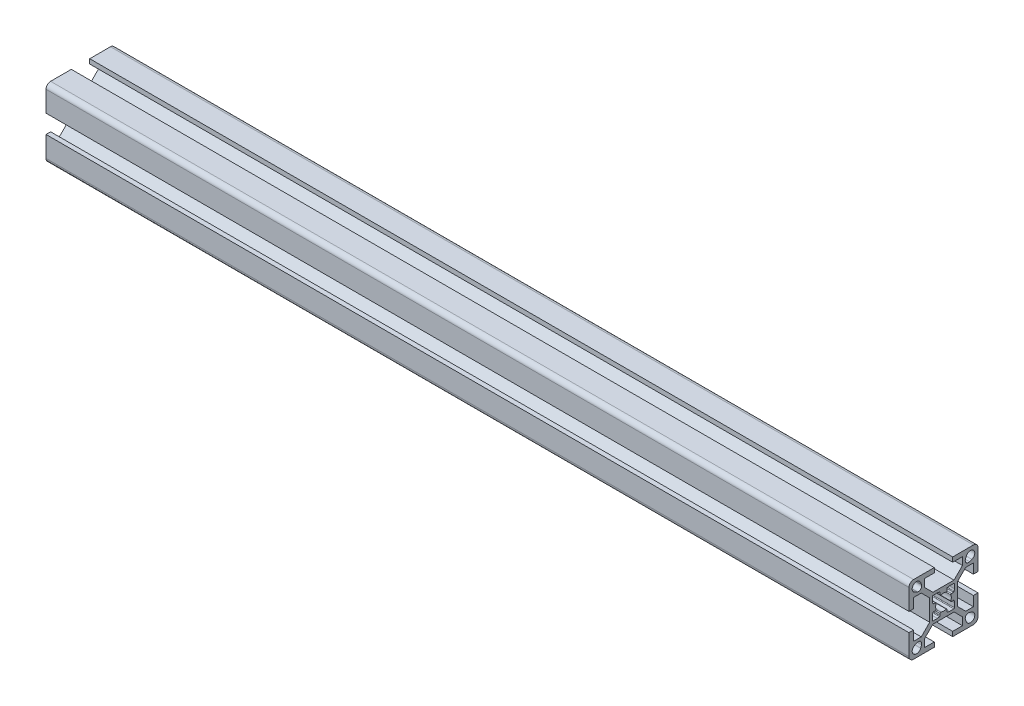
from build123d import *

# Parameters (mm, degrees)
BOSS_EXTRUDE1_DEPTH = 375


with BuildPart() as part:
    # Sketch1 → Boss-Extrude1 (new body)
    with BuildSketch(Plane(origin=(0, 0, 0), x_dir=(0, 0, -1), z_dir=(1, 0, 0))):
        with BuildLine():
            Line((-15, 13), (-15, 4))
            Line((-15, 4), (-13, 4))
            Line((-13, 4), (-13, 8.25))
            Line((-13, 8.25), (-9.664213562, 8.25))
            Line((-9.664213562, 8.25), (-6, 4.585786438))
            Line((-6, 4.585786438), (-6, -4.585786438))
            Line((-6, -4.585786438), (-9.664213562, -8.25))
            Line((-9.664213562, -8.25), (-13, -8.25))
            Line((-13, -8.25), (-13, -4))
            Line((-13, -4), (-15, -4))
            Line((-15, -4), (-15, -13))
            ThreePointArc((-15, -13), (-14.414213562, -14.414213562), (-13, -15))
            Line((-13, -15), (-4, -15))
            Line((-4, -15), (-4, -13))
            Line((-4, -13), (-8.25, -13))
            Line((-8.25, -13), (-8.25, -9.664213562))
            Line((-8.25, -9.664213562), (-4.585786438, -6))
            Line((-4.585786438, -6), (4.585786438, -6))
            Line((4.585786438, -6), (8.25, -9.664213562))
            Line((8.25, -9.664213562), (8.25, -13))
            Line((8.25, -13), (4, -13))
            Line((4, -13), (4, -15))
            Line((4, -15), (13, -15))
            ThreePointArc((13, -15), (14.414213562, -14.414213562), (15, -13))
            Line((15, -13), (15, -4))
            Line((15, -4), (13, -4))
            Line((13, -4), (13, -8.25))
            Line((13, -8.25), (9.664213562, -8.25))
            Line((9.664213562, -8.25), (6, -4.585786438))
            Line((6, -4.585786438), (6, 4.585786438))
            Line((6, 4.585786438), (9.664213562, 8.25))
            Line((9.664213562, 8.25), (13, 8.25))
            Line((13, 8.25), (13, 4))
            Line((13, 4), (15, 4))
            Line((15, 4), (15, 13))
            ThreePointArc((15, 13), (14.414213562, 14.414213562), (13, 15))
            Line((13, 15), (4, 15))
            Line((4, 15), (4, 13))
            Line((4, 13), (8.25, 13))
            Line((8.25, 13), (8.25, 9.664213562))
            Line((8.25, 9.664213562), (4.585786438, 6))
            Line((4.585786438, 6), (-4.585786438, 6))
            Line((-4.585786438, 6), (-8.25, 9.664213562))
            Line((-8.25, 9.664213562), (-8.25, 13))
            Line((-8.25, 13), (-4, 13))
            Line((-4, 13), (-4, 15))
            Line((-4, 15), (-13, 15))
            ThreePointArc((-13, 15), (-14.414213562, 14.414213562), (-15, 13))
        make_face()
        with BuildLine():
            Line((-9.539070071, 11.338915743), (-9.918883282, 12.361530981))
            ThreePointArc((-9.918883282, 12.361530981), (-13.043502884, 13.043502884), (-12.361530981, 9.918883282))
            Line((-12.361530981, 9.918883282), (-11.338915743, 9.539070071))
            ThreePointArc((-11.338915743, 9.539070071), (-9.861522369, 9.861522369), (-9.539070071, 11.338915743))
        make_face(mode=Mode.SUBTRACT)
        with BuildLine():
            Line((9.918883282, 12.361530981), (9.539070071, 11.338915743))
            ThreePointArc((9.539070071, 11.338915743), (9.861522369, 9.861522369), (11.338915743, 9.539070071))
            Line((11.338915743, 9.539070071), (12.361530981, 9.918883282))
            ThreePointArc((12.361530981, 9.918883282), (13.043502884, 13.043502884), (9.918883282, 12.361530981))
        make_face(mode=Mode.SUBTRACT)
        with BuildLine():
            Line((12.361530981, -9.918883282), (11.338915743, -9.539070071))
            ThreePointArc((11.338915743, -9.539070071), (9.861522369, -9.861522369), (9.539070071, -11.338915743))
            Line((9.539070071, -11.338915743), (9.918883282, -12.361530981))
            ThreePointArc((9.918883282, -12.361530981), (13.043502884, -13.043502884), (12.361530981, -9.918883282))
        make_face(mode=Mode.SUBTRACT)
        with BuildLine():
            Line((-11.338915743, -9.539070071), (-12.361530981, -9.918883282))
            ThreePointArc((-12.361530981, -9.918883282), (-13.043502884, -13.043502884), (-9.918883282, -12.361530981))
            Line((-9.918883282, -12.361530981), (-9.539070071, -11.338915743))
            ThreePointArc((-9.539070071, -11.338915743), (-9.861522369, -9.861522369), (-11.338915743, -9.539070071))
        make_face(mode=Mode.SUBTRACT)
        with BuildLine():
            Line((-4.8, -2.644433572), (-4.8, -4.5))
            ThreePointArc((-4.8, -4.5), (-4.712132034, -4.712132034), (-4.5, -4.8))
            Line((-4.5, -4.8), (-2.644433572, -4.8))
            ThreePointArc((-2.644433572, -4.8), (-2.615679847, -4.79861886), (-2.587190874, -4.794488155))
            Line((-2.587190874, -4.794488155), (-1.742757301, -4.630346896))
            ThreePointArc((-1.742757301, -4.630346896), (-1.568512625, -4.526682207), (-1.5, -4.335858741))
            Line((-1.5, -4.335858741), (-1.5, -3.5))
            ThreePointArc((-1.5, -3.5), (-1.374371458, -3.255879959), (-1.102702703, -3.216216216))
            ThreePointArc((-1.102702703, -3.216216216), (0, -3.4), (1.102702703, -3.216216216))
            ThreePointArc((1.102702703, -3.216216216), (1.374371458, -3.255879959), (1.5, -3.5))
            Line((1.5, -3.5), (1.5, -4.335858741))
            ThreePointArc((1.5, -4.335858741), (1.568512625, -4.526682207), (1.742757301, -4.630346896))
            Line((1.742757301, -4.630346896), (2.587190874, -4.794488155))
            ThreePointArc((2.587190874, -4.794488155), (2.615679847, -4.79861886), (2.644433572, -4.8))
            Line((2.644433572, -4.8), (4.5, -4.8))
            ThreePointArc((4.5, -4.8), (4.712132034, -4.712132034), (4.8, -4.5))
            Line((4.8, -4.5), (4.8, -2.644433572))
            ThreePointArc((4.8, -2.644433572), (4.79861886, -2.615679847), (4.794488155, -2.587190874))
            Line((4.794488155, -2.587190874), (4.630346896, -1.742757301))
            ThreePointArc((4.630346896, -1.742757301), (4.526682207, -1.568512625), (4.335858741, -1.5))
            Line((4.335858741, -1.5), (3.5, -1.5))
            ThreePointArc((3.5, -1.5), (3.255879959, -1.374371458), (3.216216216, -1.102702703))
            ThreePointArc((3.216216216, -1.102702703), (3.4, 0), (3.216216216, 1.102702703))
            ThreePointArc((3.216216216, 1.102702703), (3.255879959, 1.374371458), (3.5, 1.5))
            Line((3.5, 1.5), (4.335858741, 1.5))
            ThreePointArc((4.335858741, 1.5), (4.526682207, 1.568512625), (4.630346896, 1.742757301))
            Line((4.630346896, 1.742757301), (4.794488155, 2.587190874))
            ThreePointArc((4.794488155, 2.587190874), (4.79861886, 2.615679847), (4.8, 2.644433572))
            Line((4.8, 2.644433572), (4.8, 4.5))
            ThreePointArc((4.8, 4.5), (4.712132034, 4.712132034), (4.5, 4.8))
            Line((4.5, 4.8), (2.644433572, 4.8))
            ThreePointArc((2.644433572, 4.8), (2.615679847, 4.79861886), (2.587190874, 4.794488155))
            Line((2.587190874, 4.794488155), (1.742757301, 4.630346896))
            ThreePointArc((1.742757301, 4.630346896), (1.568512625, 4.526682207), (1.5, 4.335858741))
            Line((1.5, 4.335858741), (1.5, 3.5))
            ThreePointArc((1.5, 3.5), (1.374371458, 3.255879959), (1.102702703, 3.216216216))
            ThreePointArc((1.102702703, 3.216216216), (0, 3.4), (-1.102702703, 3.216216216))
            ThreePointArc((-1.102702703, 3.216216216), (-1.374371458, 3.255879959), (-1.5, 3.5))
            Line((-1.5, 3.5), (-1.5, 4.335858741))
            ThreePointArc((-1.5, 4.335858741), (-1.568512625, 4.526682207), (-1.742757301, 4.630346896))
            Line((-1.742757301, 4.630346896), (-2.587190874, 4.794488155))
            ThreePointArc((-2.587190874, 4.794488155), (-2.615679847, 4.79861886), (-2.644433572, 4.8))
            Line((-2.644433572, 4.8), (-4.5, 4.8))
            ThreePointArc((-4.5, 4.8), (-4.712132034, 4.712132034), (-4.8, 4.5))
            Line((-4.8, 4.5), (-4.8, 2.644433572))
            ThreePointArc((-4.8, 2.644433572), (-4.79861886, 2.615679847), (-4.794488155, 2.587190874))
            Line((-4.794488155, 2.587190874), (-4.630346896, 1.742757301))
            ThreePointArc((-4.630346896, 1.742757301), (-4.526682207, 1.568512625), (-4.335858741, 1.5))
            Line((-4.335858741, 1.5), (-3.5, 1.5))
            ThreePointArc((-3.5, 1.5), (-3.255879959, 1.374371458), (-3.216216216, 1.102702703))
            ThreePointArc((-3.216216216, 1.102702703), (-3.4, 0), (-3.216216216, -1.102702703))
            ThreePointArc((-3.216216216, -1.102702703), (-3.255879959, -1.374371458), (-3.5, -1.5))
            Line((-3.5, -1.5), (-4.335858741, -1.5))
            ThreePointArc((-4.335858741, -1.5), (-4.526682207, -1.568512625), (-4.630346896, -1.742757301))
            Line((-4.630346896, -1.742757301), (-4.794488155, -2.587190874))
            ThreePointArc((-4.794488155, -2.587190874), (-4.79861886, -2.615679847), (-4.8, -2.644433572))
        make_face(mode=Mode.SUBTRACT)
    extrude(amount=BOSS_EXTRUDE1_DEPTH)


solid = part.part
